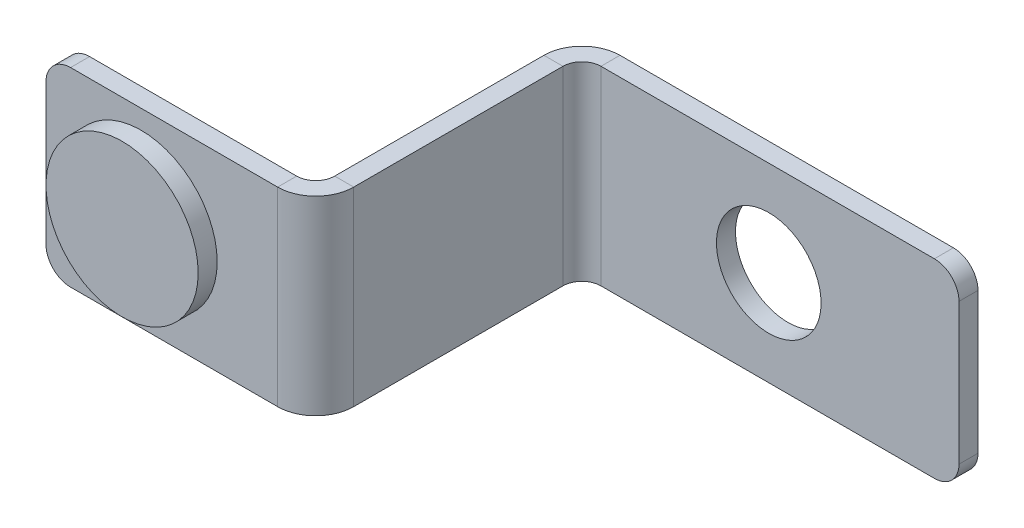
from build123d import *
from build123d.topology import SkipClean

# Parameters (mm, degrees)
SKETCH1_R           = 2.75
BASE_FLANGE1_DEPTH  = 1
JOG1_DEPTH          = 10
JOG1_START          = 1.292775665
JOG1_2_DEPTH        = 7.41444867
JOG1_START_2        = 12
JOG1_3_DEPTH        = 1.974011807
JOG1_4_OUTLINE_W    = 1
JOG1_4_OUTLINE_H    = 1.292775665
JOG1_4_DEPTH        = 12.152182036
JOG1_START_3        = 13
JOG1_5_DEPTH        = 1
JOG1_6_DEPTH        = 10
JOG1_7_DEPTH        = 10
SKETCH7_R           = 4
BOSS_EXTRUDE1_DEPTH = 1


with BuildPart() as part:
    # Base-Flange1: sheet metal written as solids
    # Sketch1 → Base-Flange1 (new body)
    with BuildSketch(Plane.XY):
        with BuildLine():
            Line((1.292775665, 0), (32.707224335, 0))
            ThreePointArc((32.707224335, 0), (33.621354774, 0.378645226), (34, 1.292775665))
            Line((34, 1.292775665), (34, 8.707224335))
            ThreePointArc((34, 8.707224335), (33.621354774, 9.621354774), (32.707224335, 10))
            Line((32.707224335, 10), (1.292775665, 10))
            ThreePointArc((1.292775665, 10), (0.378645226, 9.621354774), (0, 8.707224335))
            Line((0, 8.707224335), (0, 1.292775665))
            ThreePointArc((0, 1.292775665), (0.378645226, 0.378645226), (1.292775665, 0))
        make_face()
        with Locations((24, 5)):
            Circle(SKETCH1_R, mode=Mode.SUBTRACT)
    extrude(amount=-BASE_FLANGE1_DEPTH)

    # Jog1: read off the stored shape, not the designer's step
    # Jog1 outline → Jog1 (cut)
    with BuildSketch(Plane(origin=(0, 0, 0), x_dir=(1, 0, 0), z_dir=(0, 1, 0))):
        with BuildLine():
            Line((0, 0), (13.446046438, 0))
            ThreePointArc((13.446046438, 0), (14.178097245, 0.732050807), (15.178097245, 1))
            Line((15.178097245, 1), (0, 1))
            Line((0, 1), (0, 0))
        make_face()
    extrude(amount=JOG1_DEPTH, mode=Mode.SUBTRACT)

    # Jog1 2 outline → Jog1 2 (add)
    with BuildSketch(Plane(origin=(0, 0, 0), x_dir=(1, 0, 0), z_dir=(0, 1, 0)).offset(JOG1_START)):
        with BuildLine():
            Line((13.178097245, -1), (13.178097245, -12))
            ThreePointArc((13.178097245, -12), (12.885204026, -12.707106781), (12.178097245, -13))
            Line((12.178097245, -13), (0, -13))
            Line((0, -13), (0, -14))
            Line((0, -14), (12.178097245, -14))
            ThreePointArc((12.178097245, -14), (13.592310807, -13.414213562), (14.178097245, -12))
            Line((14.178097245, -12), (14.178097245, -1))
            ThreePointArc((14.178097245, -1), (14.470990464, -0.292893219), (15.178097245, 0))
            Line((15.178097245, 0), (13.446046438, 0))
            ThreePointArc((13.446046438, 0), (13.246245593, -0.48236191), (13.178097245, -1))
        make_face()
    extrude(amount=JOG1_2_DEPTH)

    # Jog1 3 outline → Jog1 3 (add)
    with BuildSketch(Plane.XY.offset(JOG1_START_2)):
        with BuildLine():
            Line((14.178097245, 0), (14.178097245, 1.292775665))
            Line((14.178097245, 1.292775665), (0, 1.292775665))
            ThreePointArc((0, 1.292775665), (0.378645226, 0.378645226), (1.292775665, 0))
            Line((1.292775665, 0), (14.178097245, 0))
        make_face()
        with BuildLine():
            Line((0, 8.707224335), (14.178097245, 8.707224335))
            Line((14.178097245, 8.707224335), (14.178097245, 10))
            Line((14.178097245, 10), (1.292775665, 10))
            ThreePointArc((1.292775665, 10), (0.378645226, 9.621354774), (0, 8.707224335))
        make_face()
    extrude(amount=JOG1_3_DEPTH)

    # Jog1 4 outline → Jog1 4 (add)
    with BuildSketch(Plane.XY):
        with Locations((13.678097245, 0.646387833)):
            Rectangle(JOG1_4_OUTLINE_W, JOG1_4_OUTLINE_H)
        with Locations((13.678097245, 9.353612167)):
            Rectangle(JOG1_4_OUTLINE_W, JOG1_4_OUTLINE_H)
    extrude(amount=JOG1_4_DEPTH)

    # Jog1 5 outline → Jog1 5 (add)
    with BuildSketch(Plane.XY.offset(JOG1_START_3)):
        with BuildLine():
            Line((1.292775665, 0), (13.178097245, 0))
            Line((13.178097245, 0), (13.178097245, 1.292775665))
            Line((13.178097245, 1.292775665), (0, 1.292775665))
            ThreePointArc((0, 1.292775665), (0.378645226, 0.378645226), (1.292775665, 0))
        make_face()
        with BuildLine():
            Line((0, 8.707224335), (13.178097245, 8.707224335))
            Line((13.178097245, 8.707224335), (13.178097245, 10))
            Line((13.178097245, 10), (1.292775665, 10))
            ThreePointArc((1.292775665, 10), (0.378645226, 9.621354774), (0, 8.707224335))
        make_face()
    extrude(amount=JOG1_5_DEPTH)

    # Jog1 6 outline → Jog1 6 (cut)
    with SkipClean():  # the faces are left unmerged after this step: merging them gives an invalid solid
        with BuildSketch(Plane(origin=(0, 0, 0), x_dir=(1, 0, 0), z_dir=(0, 1, 0))):
            with BuildLine():
                ThreePointArc((13.178097245, -1), (13.246245593, -0.48236191), (13.446046438, 0))
                ThreePointArc((13.446046438, 0), (13.763883685, 0.414213564), (14.178097249, 0.732050809))
                Line((14.178097249, 0.732050809), (14.178097253, 1))
                Line((14.178097253, 1), (-1, 1))
                Line((-1, 1), (-1, -13))
                Line((-1, -13), (12.178097245, -13))
                ThreePointArc((12.178097245, -13), (12.885204026, -12.707106781), (13.178097245, -12))
                Line((13.178097245, -12), (13.178097245, -1))
            make_face()
            with BuildLine():
                Line((13.178097245, -14), (13.178097245, -13.974011807))
                Line((13.178097245, -13.974011807), (14.178097245, -13.974011807))
                Line((14.178097245, -13.974011807), (14.178097245, -12))
                ThreePointArc((14.178097245, -12), (13.592310807, -13.414213562), (12.178097245, -14))
                Line((12.178097245, -14), (-1, -14.000000008))
                Line((-1, -14.000000008), (-1, -15))
                Line((-1, -15), (13.178097236, -15))
                Line((13.178097236, -15), (13.178097245, -14))
            make_face()
        extrude(amount=JOG1_6_DEPTH, mode=Mode.SUBTRACT)
    add(part.part.scale(1), mode=Mode.REPLACE)  # the faces are merged on a copy

    # Jog1 7 outline → Jog1 7 (add)
    with BuildSketch(Plane(origin=(0, 0, 0), x_dir=(1, 0, 0), z_dir=(0, 1, 0))):
        with BuildLine():
            ThreePointArc((15.178097245, 1), (14.660459157, 0.931851653), (14.178097249, 0.732050809))
            Line((14.178097249, 0.732050809), (14.178097252, 0))
            Line((14.178097252, 0), (14.178097245, -1))
            ThreePointArc((14.178097245, -1), (14.470990464, -0.292893219), (15.178097245, 0))
            Line((15.178097245, 0), (17, 1e-09))
            Line((17, 1e-09), (17, 1))
            Line((17, 1), (15.178097245, 1))
        make_face()
    extrude(amount=JOG1_7_DEPTH)


with BuildPart() as body_2:
    # Sketch7 → Boss-Extrude1 (new body)
    with BuildSketch(Plane.XY.offset(14)):
        with Locations((5, 5)):
            Circle(SKETCH7_R)
    extrude(amount=BOSS_EXTRUDE1_DEPTH)


solid = Compound([part.part, body_2.part])
